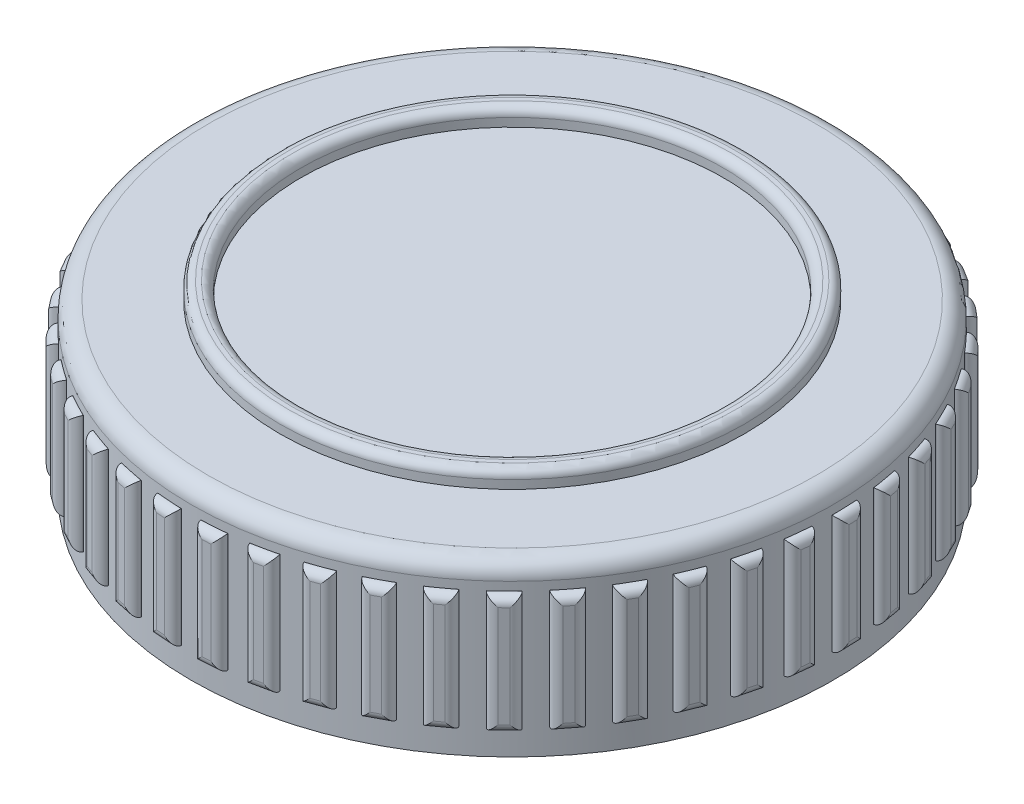
from build123d import *

# Parameters (mm, degrees)
SKETCH1_R                = 38
BOSS_EXTRUDE1_DEPTH      = 20
SHELL1_T                 = -3
BOSS_EXTRUDE2_START      = 20
SKETCH2_R                = 27.5
SKETCH2_R_2              = 25
BOSS_EXTRUDE2_DEPTH      = 2
BOSS_EXTRUDE3_START      = 3
SKETCH4_W                = 3
SKETCH4_H                = 1.085262205
BOSS_EXTRUDE3_DEPTH      = 14
FILLET1_R                = 1
CIRPATTERN2_COUNT        = 45
FILLET1_OF_CIRPATTERN2_R = 1
FILLET2_R                = 1
FILLET3_R                = 2


with BuildPart() as part:
    # Sketch1 → Boss-Extrude1 (new body)
    with BuildSketch(Plane(origin=(0, 0, 0), x_dir=(1, 0, 0), z_dir=(0, 1, 0))):
        with Locations(Location((0, 0, 0), (0, 0, 270))):
            Circle(SKETCH1_R)
    extrude(amount=BOSS_EXTRUDE1_DEPTH)

    # Shell1
    shell1_openings = [part.faces().sort_by_distance(p)[0] for p in [
        (0, 0, 0),
    ]]
    offset(amount=SHELL1_T, openings=shell1_openings, kind=Kind.INTERSECTION)

    # Sketch2 → Boss-Extrude2 (add)
    with BuildSketch(Plane(origin=(0, 0, 0), x_dir=(1, 0, 0), z_dir=(0, 1, 0)).offset(BOSS_EXTRUDE2_START)):
        with Locations(Location((0, 0, 0), (0, 0, 270))):
            Circle(SKETCH2_R)
        with Locations(Location((0, 0, 0), (0, 0, 270))):
            Circle(SKETCH2_R_2, mode=Mode.SUBTRACT)
    extrude(amount=BOSS_EXTRUDE2_DEPTH)

    # Sketch4 → Boss-Extrude3 (add)
    with BuildSketch(Plane(origin=(0, 0, 0), x_dir=(1, 0, 0), z_dir=(0, 1, 0)).offset(BOSS_EXTRUDE3_START)):
        with Locations((0, 38.457368898)):
            Rectangle(SKETCH4_W, SKETCH4_H)
    boss_extrude3 = extrude(amount=BOSS_EXTRUDE3_DEPTH)

    # Fillet1
    fillet1_edges = [part.edges().sort_by_distance(p)[0] for p in [
        (-1.5, 10, -39),
        (0, 3, -39),
        (1.5, 10, -39),
        (0, 17, -39),
    ]]
    fillet(fillet1_edges, radius=FILLET1_R - 0.0001)  # a hair under: the kernel refuses the full size

    # CirPattern2: Boss-Extrude3 ×45 about axis
    cirpattern2_axis = Axis((0, 0, 0), (0, 1, 0))
    for i in range(1, CIRPATTERN2_COUNT):
        add(boss_extrude3.rotate(cirpattern2_axis, i * 360 / CIRPATTERN2_COUNT))

    # Fillet1 of CirPattern2
    fillet1_of_cirpattern2_edges = [part.edges().sort_by_distance(p)[0] for p in [
        (-6.913153041, 10, -38.411695029),
        (-5.427750937, 3, -38.620454681),
        (-3.942348834, 10, -38.829214332),
        (-5.427750937, 17, -38.620454681),
        (-12.191749421, 10, -37.075750108),
        (-10.749856877, 3, -37.489206142),
        (-9.307964333, 10, -37.902662175),
        (-10.749856877, 17, -37.489206142),
        (-17.233047266, 10, -35.018167883),
        (-15.86272908, 3, -35.628272848),
        (-14.492410893, 10, -36.238377813),
        (-15.86272908, 17, -35.628272848),
        (-21.938923449, 10, -32.278996854),
        (-20.666851305, 3, -33.07387575),
        (-19.394779161, 10, -33.868754646),
        (-20.666851305, 17, -33.07387575),
        (-26.217783442, 10, -28.911551867),
        (-25.068716778, 3, -29.875733282),
        (-23.919650113, 10, -30.839914696),
        (-25.068716778, 17, -29.875733282),
        (-29.986344103, 10, -24.98137641),
        (-28.982648194, 3, -26.096093648),
        (-27.978952284, 10, -27.210810886),
        (-28.982648194, 17, -26.096093648),
        (-33.171254685, 10, -20.564966877),
        (-32.33246533, 3, -21.808523235),
        (-31.493675974, 10, -23.052079594),
        (-32.33246533, 17, -21.808523235),
        (-35.710524526, 10, -15.748283655),
        (-35.052967806, 3, -17.096474725),
        (-34.395411085, 10, -18.444665794),
        (-35.052967806, 17, -17.096474725),
        (-37.554729627, 10, -10.625078006),
        (-37.091204136, 3, -12.051662781),
        (-36.627678644, 10, -13.478247555),
        (-37.091204136, 17, -12.051662781),
        (-38.667974634, 10, -5.295067299),
        (-38.407502367, 3, -6.772278929),
        (-38.147030101, 10, -8.249490559),
        (-38.407502367, 17, -6.772278929),
        (-39.028591499, 10, 0.138005869),
        (-38.976242254, 3, -1.361080371),
        (-38.923893009, 10, -2.860166612),
        (-38.976242254, 17, -1.361080371),
        (-38.629561224, 10, 5.56839291),
        (-38.786353919, 3, 4.076610067),
        (-38.943146614, 10, 2.584827224),
        (-38.786353919, 17, 4.076610067),
        (-37.478650481, 10, 10.890397518),
        (-37.841533325, 3, 9.434953928),
        (-38.204416168, 10, 7.979510339),
        (-37.841533325, 17, 9.434953928),
        (-35.598260438, 10, 16.000432925),
        (-36.160170328, 3, 14.609657143),
        (-36.722080218, 10, 13.218881361),
        (-36.160170328, 17, 14.609657143),
        (-33.024990748, 10, 20.799038106),
        (-33.774990748, 3, 19.5),
        (-34.524990748, 10, 18.200961894),
        (-33.774990748, 17, 19.5),
        (-29.808927178, 10, 25.192813668),
        (-30.732419391, 3, 24.010797538),
        (-31.655911604, 10, 22.828781407),
        (-30.732419391, 17, 24.010797538),
        (-26.012666747, 10, 29.096239769),
        (-27.091676448, 3, 28.054252213),
        (-28.170686148, 10, 27.012264658),
        (-27.091676448, 17, 28.054252213),
        (-21.710099348, 10, 32.433340659),
        (-22.923624839, 3, 31.551662781),
        (-24.137150331, 10, 30.669984902),
        (-22.923624839, 17, 31.551662781),
        (-16.984969559, 10, 35.139163466),
        (-18.309390949, 3, 34.434956121),
        (-19.633812338, 10, 33.730748777),
        (-18.309390949, 17, 34.434956121),
        (-11.929246659, 10, 37.161042426),
        (-13.33878559, 3, 36.648012211),
        (-14.748324521, 10, 36.134981996),
        (-13.33878559, 17, 36.648012211),
        (-6.641334541, 10, 38.459623965),
        (-8.108555942, 3, 38.147756429),
        (-9.575777343, 10, 37.835888892),
        (-8.108555942, 17, 38.147756429),
        (-1.224156401, 10, 39.009632671),
        (-2.720502476, 3, 38.90499796),
        (-4.216848551, 10, 38.80036325),
        (-2.720502476, 17, 38.90499796),
        (4.216848551, 10, 38.80036325),
        (2.720502476, 3, 38.90499796),
        (1.224156401, 10, 39.009632671),
        (2.720502476, 17, 38.90499796),
        (9.575777343, 10, 37.835888892),
        (8.108555942, 3, 38.147756429),
        (6.641334541, 10, 38.459623965),
        (8.108555942, 17, 38.147756429),
        (14.748324521, 10, 36.134981996),
        (13.33878559, 3, 36.648012211),
        (11.929246659, 10, 37.161042426),
        (13.33878559, 17, 36.648012211),
        (19.633812338, 10, 33.730748777),
        (18.309390949, 3, 34.434956121),
        (16.984969559, 10, 35.139163466),
        (18.309390949, 17, 34.434956121),
        (24.137150331, 10, 30.669984902),
        (22.923624839, 3, 31.551662781),
        (21.710099348, 10, 32.433340659),
        (22.923624839, 17, 31.551662781),
        (28.170686148, 10, 27.012264658),
        (27.091676448, 3, 28.054252213),
        (26.012666747, 10, 29.096239769),
        (27.091676448, 17, 28.054252213),
        (31.655911604, 10, 22.828781407),
        (30.732419391, 3, 24.010797538),
        (29.808927178, 10, 25.192813668),
        (30.732419391, 17, 24.010797538),
        (34.524990748, 10, 18.200961894),
        (33.774990748, 3, 19.5),
        (33.024990748, 10, 20.799038106),
        (33.774990748, 17, 19.5),
        (36.722080218, 10, 13.218881361),
        (36.160170328, 3, 14.609657143),
        (35.598260438, 10, 16.000432925),
        (36.160170328, 17, 14.609657143),
        (38.204416168, 10, 7.979510339),
        (37.841533325, 3, 9.434953928),
        (37.478650481, 10, 10.890397518),
        (37.841533325, 17, 9.434953928),
        (38.943146614, 10, 2.584827224),
        (38.786353919, 3, 4.076610067),
        (38.629561224, 10, 5.56839291),
        (38.786353919, 17, 4.076610067),
        (38.923893009, 10, -2.860166612),
        (38.976242254, 3, -1.361080371),
        (39.028591499, 10, 0.138005869),
        (38.976242254, 17, -1.361080371),
        (38.147030101, 10, -8.249490559),
        (38.407502367, 3, -6.772278929),
        (38.667974634, 10, -5.295067299),
        (38.407502367, 17, -6.772278929),
        (36.627678644, 10, -13.478247555),
        (37.091204136, 3, -12.051662781),
        (37.554729627, 10, -10.625078006),
        (37.091204136, 17, -12.051662781),
        (34.395411085, 10, -18.444665794),
        (35.052967806, 3, -17.096474725),
        (35.710524526, 10, -15.748283655),
        (35.052967806, 17, -17.096474725),
        (31.493675974, 10, -23.052079594),
        (32.33246533, 3, -21.808523235),
        (33.171254685, 10, -20.564966877),
        (32.33246533, 17, -21.808523235),
        (27.978952284, 10, -27.210810886),
        (28.982648194, 3, -26.096093648),
        (29.986344103, 10, -24.98137641),
        (28.982648194, 17, -26.096093648),
        (23.919650113, 10, -30.839914696),
        (25.068716778, 3, -29.875733282),
        (26.217783442, 10, -28.911551867),
        (25.068716778, 17, -29.875733282),
        (19.394779161, 10, -33.868754646),
        (20.666851305, 3, -33.07387575),
        (21.938923449, 10, -32.278996854),
        (20.666851305, 17, -33.07387575),
        (14.492410893, 10, -36.238377813),
        (15.86272908, 3, -35.628272848),
        (17.233047266, 10, -35.018167883),
        (15.86272908, 17, -35.628272848),
        (9.307964333, 10, -37.902662175),
        (10.749856877, 3, -37.489206142),
        (12.191749421, 10, -37.075750108),
        (10.749856877, 17, -37.489206142),
        (3.942348834, 10, -38.829214332),
        (5.427750937, 3, -38.620454681),
        (6.913153041, 10, -38.411695029),
        (5.427750937, 17, -38.620454681),
    ]]
    fillet(fillet1_of_cirpattern2_edges, radius=FILLET1_OF_CIRPATTERN2_R - 0.0001)  # a hair under: the kernel refuses the full size

    # Fillet2
    fillet2_edges = [part.edges().sort_by_distance(p)[0] for p in [
        (0, 22, -27.5),
        (0, 22, -25),
    ]]
    fillet(fillet2_edges, radius=FILLET2_R)

    # Fillet3
    fillet3_edges = [part.edges().sort_by_distance(p)[0] for p in [
        (0, 20, -38),
    ]]
    fillet(fillet3_edges, radius=FILLET3_R)


solid = part.part
